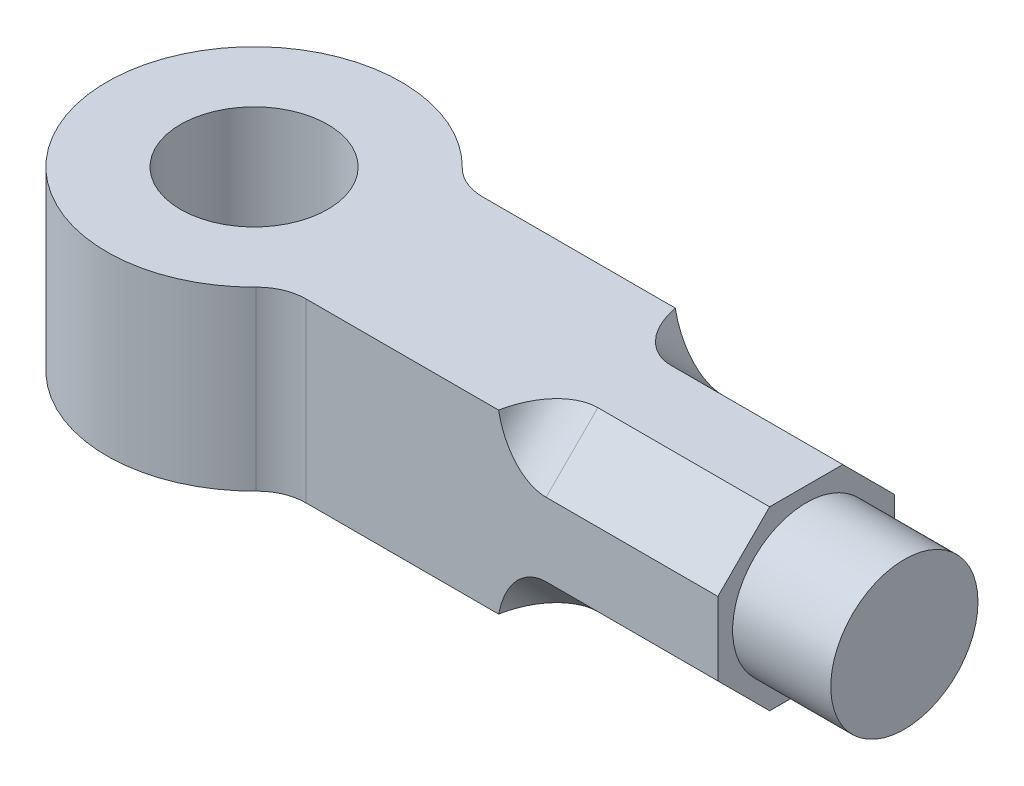
from build123d import *

# Parameters (mm, degrees)
CROQUIS1_R              = 15
SALIENTE_EXTRUIR1_DEPTH = 18
SALIENTE_EXTRUIR2_DEPTH = 45
CROQUIS3_R              = 15
SALIENTE_EXTRUIR3_DEPTH = 20
REDONDEO1_R             = 10
REDONDEO2_R             = 10


with BuildPart() as part:
    # Croquis1 → Saliente-Extruir1 (new, symmetric)
    with BuildSketch(Plane(origin=(0, 0, 0), x_dir=(1, 0, 0), z_dir=(0, 1, 0))):
        with BuildLine():
            Line((24, 18), (67.5, 18))
            Line((67.5, 18), (67.5, -18))
            Line((67.5, -18), (24, -18))
            ThreePointArc((24, -18), (-30, 0), (24, 18))
        make_face()
        with Locations(Location((0, 0, 0), (0, 0, 270))):
            Circle(CROQUIS1_R, mode=Mode.SUBTRACT)
    extrude(amount=SALIENTE_EXTRUIR1_DEPTH, both=True)

    # Croquis2 → Saliente-Extruir2 (add)
    with BuildSketch(Plane(origin=(67.5, 0, 0), x_dir=(0, 0, -1), z_dir=(1, 0, 0))):
        Polygon((-18, 7.455844123), (-18, -7.455844123), (-7.455844123, -18), (7.455844123, -18), (18, -7.455844123), (18, 7.455844123), (7.455844123, 18), (-7.455844123, 18), align=None)
    extrude(amount=SALIENTE_EXTRUIR2_DEPTH)

    # Croquis3 → Saliente-Extruir3 (add)
    with BuildSketch(Plane(origin=(112.5, 0, 0), x_dir=(0, 0, -1), z_dir=(1, 0, 0))):
        Circle(CROQUIS3_R)
    extrude(amount=SALIENTE_EXTRUIR3_DEPTH)

    # Redondeo1
    # the kernel refuses this fillet: 10 mm, written as the material it adds along each edge
    with BuildSketch(Plane(origin=(67.5, 10.221825407, 35.67766953), x_dir=(1, 0, 0), z_dir=(0, -0.7071067811865474, -0.7071067811865477))) as redondeo1_piece_1_section:
        with BuildLine():
            CenterArc((REDONDEO1_R, REDONDEO1_R), REDONDEO1_R, 180, 90)
            Line((0, REDONDEO1_R), (0, 0))
            Line((0, 0), (REDONDEO1_R, 0))
        make_face()
    redondeo1_piece_1 = extrude(amount=64.911688245, mode=Mode.PRIVATE)
    redondeo1_piece_1 = split(redondeo1_piece_1, bisect_by=Plane(origin=(70.275136412, -18, 13.729156697), z_dir=(0, 1, 0)), keep=Keep.TOP, mode=Mode.PRIVATE)
    redondeo1_piece_1 = split(redondeo1_piece_1, bisect_by=Plane(origin=(70.275136412, -13.729156697, 18), z_dir=(0, 0, -1)), keep=Keep.TOP, mode=Mode.PRIVATE)
    add(redondeo1_piece_1)
    with BuildSketch(Plane(origin=(67.5, -35.67766953, 10.221825407), x_dir=(0, -0.7071067811865476, -0.7071067811865476), z_dir=(0, 0.7071067811865475, -0.7071067811865476))) as redondeo1_piece_2_section:
        with BuildLine():
            CenterArc((REDONDEO1_R, -REDONDEO1_R), REDONDEO1_R, 90, 90)
            Line((0, -REDONDEO1_R), (0, 0))
            Line((0, 0), (REDONDEO1_R, 0))
        make_face()
    redondeo1_piece_2 = extrude(amount=64.911688245, mode=Mode.PRIVATE)
    redondeo1_piece_2 = split(redondeo1_piece_2, bisect_by=Plane(origin=(70.275136413, -13.729156697, -18), z_dir=(0, 0, 1)), keep=Keep.TOP, mode=Mode.PRIVATE)
    redondeo1_piece_2 = split(redondeo1_piece_2, bisect_by=Plane(origin=(70.275136413, -18, -13.729156697), z_dir=(0, 1, 0)), keep=Keep.TOP, mode=Mode.PRIVATE)
    add(redondeo1_piece_2)
    with BuildSketch(Plane(origin=(67.5, -10.221825407, -35.67766953), x_dir=(1, 0, 0), z_dir=(0, 0.7071067811865477, 0.7071067811865474))) as redondeo1_piece_3_section:
        with BuildLine():
            CenterArc((REDONDEO1_R, REDONDEO1_R), REDONDEO1_R, 180, 90)
            Line((0, REDONDEO1_R), (0, 0))
            Line((0, 0), (REDONDEO1_R, 0))
        make_face()
    redondeo1_piece_3 = extrude(amount=64.911688245, mode=Mode.PRIVATE)
    redondeo1_piece_3 = split(redondeo1_piece_3, bisect_by=Plane(origin=(70.275136412, 13.729156697, -18), z_dir=(0, 0, 1)), keep=Keep.TOP, mode=Mode.PRIVATE)
    redondeo1_piece_3 = split(redondeo1_piece_3, bisect_by=Plane(origin=(70.275136412, 18, -13.729156697), z_dir=(0, -1, 0)), keep=Keep.TOP, mode=Mode.PRIVATE)
    add(redondeo1_piece_3)
    with BuildSketch(Plane(origin=(67.5, 35.67766953, -10.221825407), x_dir=(1, 0, 0), z_dir=(0, -0.7071067811865476, 0.7071067811865476))) as redondeo1_piece_4_section:
        with BuildLine():
            CenterArc((REDONDEO1_R, REDONDEO1_R), REDONDEO1_R, 180, 90)
            Line((0, REDONDEO1_R), (0, 0))
            Line((0, 0), (REDONDEO1_R, 0))
        make_face()
    redondeo1_piece_4 = extrude(amount=64.911688245, mode=Mode.PRIVATE)
    redondeo1_piece_4 = split(redondeo1_piece_4, bisect_by=Plane(origin=(70.275136412, 18, 13.729156697), z_dir=(0, -1, 0)), keep=Keep.TOP, mode=Mode.PRIVATE)
    redondeo1_piece_4 = split(redondeo1_piece_4, bisect_by=Plane(origin=(70.275136412, 13.729156697, 18), z_dir=(0, 0, -1)), keep=Keep.TOP, mode=Mode.PRIVATE)
    add(redondeo1_piece_4)

    # Redondeo2
    redondeo2_edges = [part.edges().sort_by_distance(p)[0] for p in [
        (24, 0, 18),
        (24, 0, -18),
    ]]
    fillet(redondeo2_edges, radius=REDONDEO2_R)


solid = part.part
